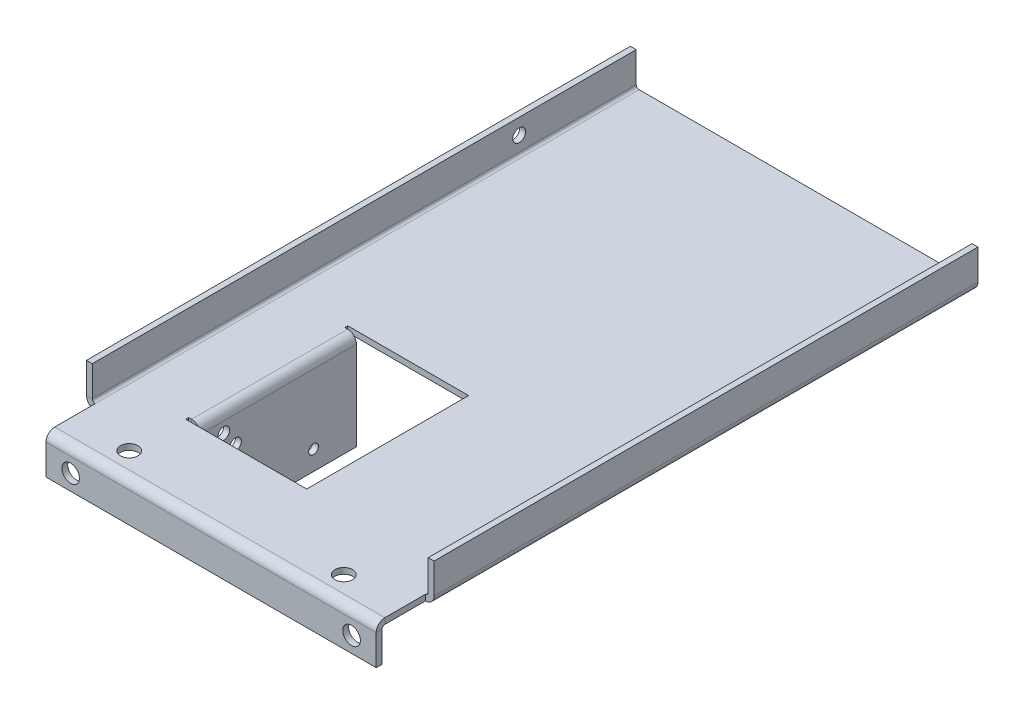
from build123d import *

# Parameters (mm, degrees)
SKETCH_2_W                       = 89.1
SKETCH_2_H                       = 1.5
SM_BASE_FLANGE_1_DEPTH           = 152
SM_EDGE_FLANGE_1_STRIP_W         = 7.4732
SM_EDGE_FLANGE_1_STRIP_H         = 1.5
SM_EDGE_FLANGE_1_STRIP_CUT_DEPTH = 152
SM_EDGE_FLANGE_1_DEPTH           = 152
SM_EDGE_FLANGE_2_STRIP_W         = 7.4732
SM_EDGE_FLANGE_2_STRIP_H         = 1.5
SM_EDGE_FLANGE_2_STRIP_CUT_DEPTH = 152
SM_EDGE_FLANGE_2_DEPTH           = 152
SKETCH_13_W                      = 16.114616681
SKETCH_13_H                      = 12.6
SKETCH_13_W_2                    = 14.895249376
CUT_EXTRUDE_1_DEPTH              = 177.473255764
SM_EDGE_FLANGE_3_STRIP_W         = 7.4732
SM_EDGE_FLANGE_3_STRIP_H         = 1.5
SM_EDGE_FLANGE_3_STRIP_CUT_DEPTH = 84.6268
SM_EDGE_FLANGE_3_DEPTH           = 84.6268
SKETCH_17_R                      = 2.25
CUT_EXTRUDE_2_DEPTH              = 10
SKETCH_18_R                      = 2.25
CUT_EXTRUDE_3_DEPTH              = 10
SKETCH_19_W                      = 28
SKETCH_19_H                      = 40
CUT_EXTRUDE_4_DEPTH              = 10
SM_START                         = 89.75
SM_EDGE_FLANGE_4_DEPTH           = 41.5
SM_EDGE_FLANGE_4_2_DEPTH         = 0.75
SM_START_2                       = 130.5
SM_EDGE_FLANGE_4_3_DEPTH         = 0.75
SM_START_3                       = 90.5
SM_EDGE_FLANGE_4_4_DEPTH         = 40
HOLE_WIZARD_M3_1_D               = 2.5
HOLE_WIZARD_M3_1_DEPTH           = 7.5
HOLE_WIZARD_M3_1_TIP             = 0.751075774
HOLE_WIZARD_M4_1_D               = 3.3
HOLE_WIZARD_M4_1_DEPTH           = 10.1
HOLE_WIZARD_M4_1_TIP             = 0.991420021
SKETCH_27_R                      = 1.5
CUT_EXTRUDE_5_DEPTH              = 20
SKETCH_28_R                      = 1.5
CUT_EXTRUDE_6_DEPTH              = 10
CUT_EXTRUDE_START                = -0.75
SKETCH_29_W                      = 28
SKETCH_29_H                      = 1.5
CUT_EXTRUDE_7_DEPTH              = 0.75
SKETCH_30_W                      = 28
SKETCH_30_H                      = 1.5
CUT_EXTRUDE_8_DEPTH              = 0.75


# Read off the part's stored shape, not the designer's step: 边线-法兰4
# Sheet-metal steps are written as plain solids
with BuildPart() as part:
    # Sketch 2 → 基体-法兰1 (new body)
    with BuildSketch(Plane.XY):
        with Locations((44.55, -0.75)):
            Rectangle(SKETCH_2_W, SKETCH_2_H)
    extrude(amount=SM_BASE_FLANGE_1_DEPTH)

    # 边线-法兰1 strip (across the edge) → 边线-法兰1 strip cut (cut)
    with BuildSketch(Plane.XY):
        with Locations((-1.5, -0.75)):
            Rectangle(SM_EDGE_FLANGE_1_STRIP_W, SM_EDGE_FLANGE_1_STRIP_H)
    extrude(amount=SM_EDGE_FLANGE_1_STRIP_CUT_DEPTH, mode=Mode.SUBTRACT)

    # 边线-法兰1 section (across the edge) → 边线-法兰1 (add)
    with BuildSketch(Plane.XY):
        with BuildLine():
            Line((0, 0.7366), (0, 8.5))
            Line((0, 8.5), (1.5, 8.5))
            Line((1.5, 8.5), (1.5, 0.7366))
            ThreePointArc((1.5, 0.7366), (1.715745145, 0.215745145), (2.2366, 0))
            Line((2.2366, 0), (2.2366, -1.5))
            ThreePointArc((2.2366, -1.5), (0.655084973, -0.844915027), (0, 0.7366))
        make_face()
    extrude(amount=SM_EDGE_FLANGE_1_DEPTH)

    # 边线-法兰2 strip (across the edge) → 边线-法兰2 strip cut (cut)
    with BuildSketch(Plane(origin=(89.1, 0, 152), x_dir=(-1, 0, 0), z_dir=(0, 0, -1))):
        with Locations((-1.5, -0.75)):
            Rectangle(SM_EDGE_FLANGE_2_STRIP_W, SM_EDGE_FLANGE_2_STRIP_H)
    extrude(amount=SM_EDGE_FLANGE_2_STRIP_CUT_DEPTH, mode=Mode.SUBTRACT)

    # 边线-法兰2 section (across the edge) → 边线-法兰2 (add)
    with BuildSketch(Plane(origin=(89.1, 0, 152), x_dir=(-1, 0, 0), z_dir=(0, 0, -1))):
        with BuildLine():
            Line((0, 0.7366), (0, 8.5))
            Line((0, 8.5), (1.5, 8.5))
            Line((1.5, 8.5), (1.5, 0.7366))
            ThreePointArc((1.5, 0.7366), (1.715745145, 0.215745145), (2.2366, 0))
            Line((2.2366, 0), (2.2366, -1.5))
            ThreePointArc((2.2366, -1.5), (0.655084973, -0.844915027), (0, 0.7366))
        make_face()
    extrude(amount=SM_EDGE_FLANGE_2_DEPTH)

    # 草图13 → 切除-拉伸1 (cut, through all)
    with BuildSketch(Plane.XZ.offset(1.5)):
        with Locations((-5.82070834, 145.7)):
            Rectangle(SKETCH_13_W, SKETCH_13_H)
        with Locations((94.311024688, 145.7)):
            Rectangle(SKETCH_13_W_2, SKETCH_13_H)
    extrude(amount=-CUT_EXTRUDE_1_DEPTH, mode=Mode.SUBTRACT)

    # 边线-法兰3 strip (across the edge) → 边线-法兰3 strip cut (cut)
    with BuildSketch(Plane(origin=(86.8634, -1.5, 152), x_dir=(0, 0, -1), z_dir=(-1, 0, 0))):
        with Locations((-1.5, -0.75)):
            Rectangle(SM_EDGE_FLANGE_3_STRIP_W, SM_EDGE_FLANGE_3_STRIP_H)
    extrude(amount=SM_EDGE_FLANGE_3_STRIP_CUT_DEPTH, mode=Mode.SUBTRACT)

    # 边线-法兰3 section (across the edge) → 边线-法兰3 (add)
    with BuildSketch(Plane(origin=(86.8634, -1.5, 152), x_dir=(0, 0, -1), z_dir=(-1, 0, 0))):
        with BuildLine():
            Line((0, 0.7366), (0, 8.5))
            Line((0, 8.5), (1.5, 8.5))
            Line((1.5, 8.5), (1.5, 0.7366))
            ThreePointArc((1.5, 0.7366), (1.715745145, 0.215745145), (2.2366, 0))
            Line((2.2366, 0), (2.2366, -1.5))
            ThreePointArc((2.2366, -1.5), (0.655084973, -0.844915027), (0, 0.7366))
        make_face()
    extrude(amount=SM_EDGE_FLANGE_3_DEPTH)

    # 草图17 → 切除-拉伸2 (cut)
    with BuildSketch(Plane.XY.offset(152)):
        with Locations((80.55, -6)):
            Circle(SKETCH_17_R)
        with Locations(Location((8.55, -6, 0), (0, 0, 270))):
            Circle(SKETCH_17_R)
    extrude(amount=-CUT_EXTRUDE_2_DEPTH, mode=Mode.SUBTRACT)

    # 草图18 → 切除-拉伸3 (cut)
    with BuildSketch(Plane.XZ.offset(1.5)):
        with Locations(Location((17.05, 145.5, 0), (0, 0, 270))):
            Circle(SKETCH_18_R)
        with Locations(Location((72.05, 145.5, 0), (0, 0, 90))):
            Circle(SKETCH_18_R)
    extrude(amount=-CUT_EXTRUDE_3_DEPTH, mode=Mode.SUBTRACT)

    # 草图19 → 切除-拉伸4 (cut)
    with BuildSketch(Plane.XZ.offset(1.5)):
        with Locations((34.3, 110.5)):
            Rectangle(SKETCH_19_W, SKETCH_19_H)
    extrude(amount=-CUT_EXTRUDE_4_DEPTH, mode=Mode.SUBTRACT)

    # 边线-法兰4 outline → 边线-法兰4 (cut)
    with BuildSketch(Plane.XY.offset(SM_START)):
        with BuildLine():
            Line((20.3, -1.5), (20.3, 0))
            Line((20.3, 0), (18.0634, 0))
            ThreePointArc((18.0634, 0), (19.358564082, -0.413161062), (20.175223856, -1.5))
            Line((20.175223856, -1.5), (20.3, -1.5))
        make_face()
    extrude(amount=SM_EDGE_FLANGE_4_DEPTH, mode=Mode.SUBTRACT)

    # Sm Edge Flange 4 2 outline → Sm Edge Flange 4 2 (cut)
    with BuildSketch(Plane.XY.offset(SM_START)):
        with BuildLine():
            ThreePointArc((20.175223856, -1.5), (19.358564082, -0.413161062), (18.0634, 0))
            Line((18.0634, 0), (17.3134, 0))
            Line((17.3134, 0), (17.3134, -1.5))
            Line((17.3134, -1.5), (20.175223856, -1.5))
        make_face()
    extrude(amount=SM_EDGE_FLANGE_4_2_DEPTH, mode=Mode.SUBTRACT)

    # Sm Edge Flange 4 3 outline → Sm Edge Flange 4 3 (cut)
    with BuildSketch(Plane.XY.offset(SM_START_2)):
        with BuildLine():
            ThreePointArc((20.175223856, -1.5), (19.358564082, -0.413161062), (18.0634, 0))
            Line((18.0634, 0), (17.3134, 0))
            Line((17.3134, 0), (17.3134, -1.5))
            Line((17.3134, -1.5), (20.175223856, -1.5))
        make_face()
    extrude(amount=SM_EDGE_FLANGE_4_3_DEPTH, mode=Mode.SUBTRACT)

    # Sm Edge Flange 4 4 outline → Sm Edge Flange 4 4 (add)
    with BuildSketch(Plane.XY.offset(SM_START_3)):
        with BuildLine():
            ThreePointArc((20.3, -2.2366), (20.268585343, -1.863053267), (20.175223856, -1.5))
            Line((20.175223856, -1.5), (18.0634, -1.5))
            ThreePointArc((18.0634, -1.5), (18.584254855, -1.715745145), (18.8, -2.2366))
            Line((18.8, -2.2366), (18.8, -25))
            Line((18.8, -25), (20.3, -25))
            Line((20.3, -25), (20.3, -2.2366))
        make_face()
    extrude(amount=SM_EDGE_FLANGE_4_4_DEPTH)

    # M3 螺纹孔1
    with Locations(Plane.ZY.offset(-18.8)):
        with Locations((101.5, -20), (120.5, -20)):
            Hole(HOLE_WIZARD_M3_1_D / 2, depth=HOLE_WIZARD_M3_1_DEPTH)
            with Locations((0, 0, -(HOLE_WIZARD_M3_1_DEPTH + HOLE_WIZARD_M3_1_TIP / 2))):  # 118° drill point
                Cone(0, HOLE_WIZARD_M3_1_D / 2, HOLE_WIZARD_M3_1_TIP, mode=Mode.SUBTRACT)

    # M4 螺纹孔1
    with Locations(Plane.ZY):
        with Locations((30, 4.5)):
            Hole(HOLE_WIZARD_M4_1_D / 2, depth=HOLE_WIZARD_M4_1_DEPTH)
            with Locations((0, 0, -(HOLE_WIZARD_M4_1_DEPTH + HOLE_WIZARD_M4_1_TIP / 2))):  # 118° drill point
                Cone(0, HOLE_WIZARD_M4_1_D / 2, HOLE_WIZARD_M4_1_TIP, mode=Mode.SUBTRACT)

    # 草图27 → 切除-拉伸5 (cut)
    with BuildSketch(Plane(origin=(20.3, 0, 0), x_dir=(0, 0, -1), z_dir=(1, 0, 0))):
        with Locations(Location((-121.5, -9, 0), (0, 0, 90))):
            Circle(SKETCH_27_R)
    extrude(amount=-CUT_EXTRUDE_5_DEPTH, mode=Mode.SUBTRACT)

    # 草图28 → 切除-拉伸6 (cut)
    with BuildSketch(Plane(origin=(20.3, 0, 0), x_dir=(0, 0, -1), z_dir=(1, 0, 0))):
        with Locations(Location((-124.5, -5, 0), (0, 0, 90))):
            Circle(SKETCH_28_R)
    extrude(amount=-CUT_EXTRUDE_6_DEPTH, mode=Mode.SUBTRACT)

    # 草图29 → 切除-拉伸7 (cut)
    with BuildSketch(Plane.XY.offset(90.5).offset(CUT_EXTRUDE_START)):
        with Locations((34.3, -0.75)):
            Rectangle(SKETCH_29_W, SKETCH_29_H)
    extrude(amount=CUT_EXTRUDE_7_DEPTH, mode=Mode.SUBTRACT)

    # 草图30 → 切除-拉伸8 (cut)
    with BuildSketch(Plane(origin=(0, 0, 130.5), x_dir=(-1, 0, 0), z_dir=(0, 0, -1)).offset(CUT_EXTRUDE_START)):
        with Locations((-34.3, -0.75)):
            Rectangle(SKETCH_30_W, SKETCH_30_H)
    extrude(amount=CUT_EXTRUDE_8_DEPTH, mode=Mode.SUBTRACT)


solid = part.part
